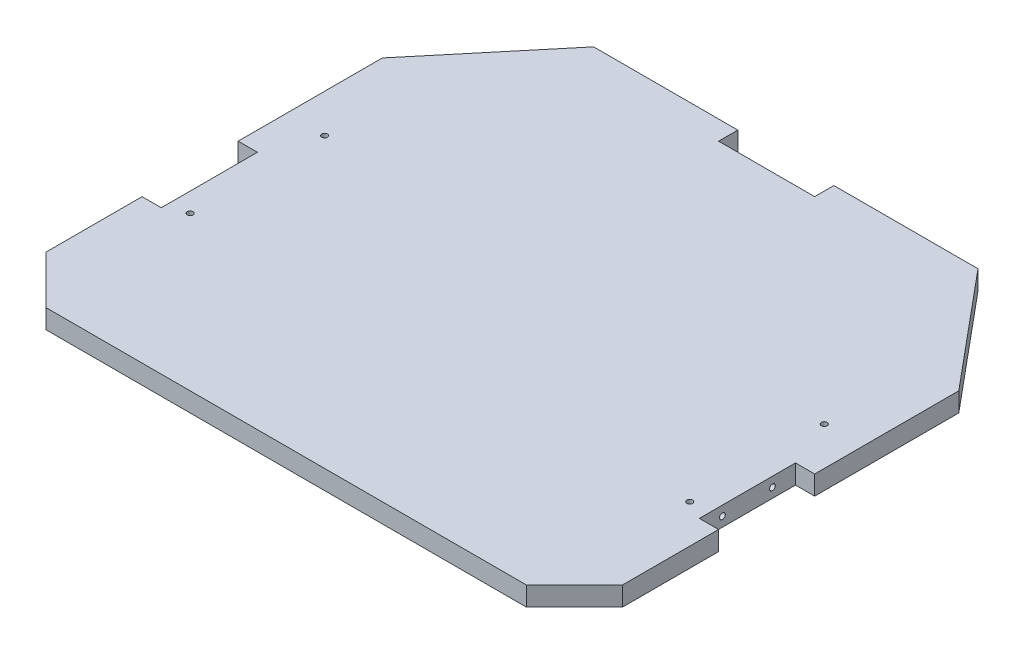
from build123d import *

# Parameters (mm, degrees)
BOSS_EXTRUDE1_DEPTH = 10
SKETCH2_R           = 1.5
CUT_EXTRUDE1_DEPTH  = 15
SKETCH3_R           = 1.5
CUT_EXTRUDE2_DEPTH  = 15
CUT_EXTRUDE3_REACH  = 302.333
SKETCH4_R           = 1.5


with BuildPart() as part:
    # Sketch1 → Boss-Extrude1 (new body)
    with BuildSketch(Plane(origin=(0, 0, 0), x_dir=(1, 0, 0), z_dir=(0, 1, 0))):
        Polygon((-100, 260), (-150, 200), (-150, 125), (-140, 125), (-140, 75), (-150, 75), (-150, 25), (-125, 0), (125, 0), (150, 25), (150, 75), (140, 75), (140, 125), (150, 125), (150, 200), (100, 260), (25, 260), (25, 250), (-25, 250), (-25, 260), align=None)
    extrude(amount=BOSS_EXTRUDE1_DEPTH)

    # Sketch2 → Cut-Extrude1 (cut)
    with BuildSketch(Plane.ZY.offset(140)):
        with Locations((-113, 5)):
            Circle(SKETCH2_R)
        with Locations((-87, 5)):
            Circle(SKETCH2_R)
    cut_extrude1 = extrude(amount=-CUT_EXTRUDE1_DEPTH, mode=Mode.SUBTRACT)

    # Mirror1: Cut-Extrude1 across plane
    add(cut_extrude1.mirror(Plane(origin=(0, 0, 0), x_dir=(0, 0, 1), z_dir=(1, 0, 0))), mode=Mode.SUBTRACT)

    # Sketch3 → Cut-Extrude2 (cut)
    with BuildSketch(Plane(origin=(0, 0, -250), x_dir=(-1, 0, 0), z_dir=(0, 0, -1))):
        with Locations((-13, 5)):
            Circle(SKETCH3_R)
        with Locations((13, 5)):
            Circle(SKETCH3_R)
    extrude(amount=-CUT_EXTRUDE2_DEPTH, mode=Mode.SUBTRACT)

    # Sketch4 → Cut-Extrude3 (cut, up to next)
    with BuildSketch(Plane(origin=(0, 10, 0), x_dir=(1, 0, 0), z_dir=(0, 1, 0)), mode=Mode.PRIVATE) as cut_extrude3_sk1:
        with Locations((-130, 80)):
            Circle(SKETCH4_R)
    cut_extrude3_tool1 = extrude(cut_extrude3_sk1.sketch, amount=-CUT_EXTRUDE3_REACH, mode=Mode.PRIVATE) & part.part
    # Sketch4 → Cut-Extrude3 (cut, up to next)
    with BuildSketch(Plane(origin=(0, 10, 0), x_dir=(1, 0, 0), z_dir=(0, 1, 0)), mode=Mode.PRIVATE) as cut_extrude3_sk2:
        with Locations((-130, 150)):
            Circle(SKETCH4_R)
    cut_extrude3_tool2 = extrude(cut_extrude3_sk2.sketch, amount=-CUT_EXTRUDE3_REACH, mode=Mode.PRIVATE) & part.part
    cut_extrude3_1 = cut_extrude3_tool1.solids().sort_by_distance((-130, 10, -80))[0]
    add(cut_extrude3_1, mode=Mode.SUBTRACT)
    cut_extrude3_2 = cut_extrude3_tool2.solids().sort_by_distance((-130, 10, -150))[0]
    add(cut_extrude3_2, mode=Mode.SUBTRACT)
    cut_extrude3 = cut_extrude3_1 + cut_extrude3_2  # Cut-Extrude3 as one shape, for the pattern or mirror that repeats it

    # Mirror2: Cut-Extrude3 across plane
    add(cut_extrude3.mirror(Plane(origin=(0, 0, 0), x_dir=(0, 0, 1), z_dir=(1, 0, 0))), mode=Mode.SUBTRACT)


solid = part.part
